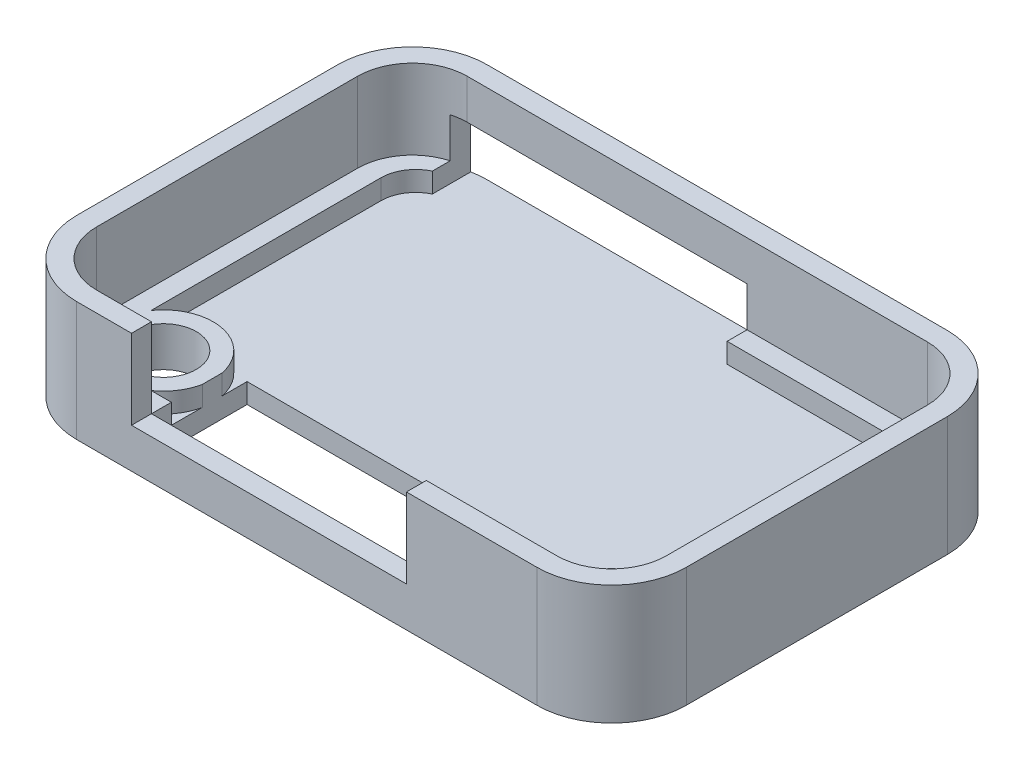
from build123d import *

# Parameters (mm, degrees)
SKETCH_1_W          = 30.6
SKETCH_1_H          = 20.6
EXTRUDE_1_DEPTH     = 6
SKETCH_2_W          = 28.6
SKETCH_2_H          = 18.6
CUT_EXTRUDE_1_DEPTH = 4
SKETCH_3_W          = 26.6
SKETCH_3_H          = 16.6
CUT_EXTRUDE_2_DEPTH = 1
FILLET_1_R          = 2.75
FILLET_2_R          = 3.75
SKETCH_4_W          = 14.8
SKETCH_4_H          = 3
CUT_EXTRUDE_3_DEPTH = 5
FILLET_3_R          = 1.75
SKETCH_5_R          = 2.5
SKETCH_5_R_2        = 1.65
EXTRUDE_2_DEPTH     = 1
CUT_EXTRUDE_START   = -2
SKETCH_6_R          = 1.65
CUT_EXTRUDE_4_DEPTH = 2
SKETCH_7_W          = 13.8
SKETCH_7_H          = 4.8
CUT_EXTRUDE_5_DEPTH = 8
SKETCH_8_W          = 13.8
SKETCH_8_H          = 4
CUT_EXTRUDE_6_DEPTH = 10


with BuildPart() as part:
    # 草图1 → 凸台-拉伸1 (new body)
    with BuildSketch(Plane(origin=(0, 0, 0), x_dir=(1, 0, 0), z_dir=(0, 1, 0))):
        Rectangle(SKETCH_1_W, SKETCH_1_H)
    extrude(amount=EXTRUDE_1_DEPTH)

    # 草图2 → 切除-拉伸1 (cut)
    with BuildSketch(Plane(origin=(0, 6, 0), x_dir=(1, 0, 0), z_dir=(0, 1, 0))):
        Rectangle(SKETCH_2_W, SKETCH_2_H)
    extrude(amount=-CUT_EXTRUDE_1_DEPTH, mode=Mode.SUBTRACT)

    # 草图3 → 切除-拉伸2 (cut)
    with BuildSketch(Plane(origin=(0, 2, 0), x_dir=(1, 0, 0), z_dir=(0, 1, 0))):
        Rectangle(SKETCH_3_W, SKETCH_3_H)
    extrude(amount=-CUT_EXTRUDE_2_DEPTH, mode=Mode.SUBTRACT)

    # 圆角1
    fillet_1_edges = [part.edges().sort_by_distance(p)[0] for p in [
        (-14.3, 4, 9.3),
        (-14.3, 4, -9.3),
        (14.3, 4, -9.3),
        (14.3, 4, 9.3),
    ]]
    fillet(fillet_1_edges, radius=FILLET_1_R)

    # 圆角2
    fillet_2_edges = [part.edges().sort_by_distance(p)[0] for p in [
        (-15.3, 3, -10.3),
        (15.3, 3, -10.3),
        (15.3, 3, 10.3),
        (-15.3, 3, 10.3),
    ]]
    fillet(fillet_2_edges, radius=FILLET_2_R)

    # 草图4 → 切除-拉伸3 (cut)
    with BuildSketch(Plane(origin=(0, 0, -10.3), x_dir=(-1, 0, 0), z_dir=(0, 0, -1))):
        with Locations((4.9, 2.5)):
            Rectangle(SKETCH_4_W, SKETCH_4_H)
    extrude(amount=-CUT_EXTRUDE_3_DEPTH, mode=Mode.SUBTRACT)

    # 圆角3
    # the kernel refuses this fillet: 1.75 mm, written as the material it adds along each edge
    with BuildSketch(Plane(origin=(-13.3, 2, 8.3), x_dir=(1, 0, 0), z_dir=(0, -1, 0)), Plane(origin=(13.3, 2, -8.3), x_dir=(-1, 0, 0), z_dir=(0, -1, 0)), Plane(origin=(13.3, 2, 8.3), x_dir=(0, 0, -1), z_dir=(0, -1, 0))) as fillet_3_piece_1:
        with BuildLine():
            CenterArc((FILLET_3_R, -FILLET_3_R), FILLET_3_R, 90, 90)
            Line((0, -FILLET_3_R), (-FILLET_3_R * 0.02, -FILLET_3_R))
            Line((-FILLET_3_R * 0.02, -FILLET_3_R), (-FILLET_3_R * 0.02, FILLET_3_R * 0.02))
            Line((-FILLET_3_R * 0.02, FILLET_3_R * 0.02), (FILLET_3_R, FILLET_3_R * 0.02))
            Line((FILLET_3_R, FILLET_3_R * 0.02), (FILLET_3_R, 0))
        make_face()
    extrude(amount=1)
    with BuildSketch(Plane(origin=(-13.3, 2, -8.3), x_dir=(1, 0, 0), z_dir=(0, -1, 0))) as fillet_3_piece_2:
        with BuildLine():
            CenterArc((1.75, 1.58113883), FILLET_3_R, 180, 64.623066475)
            Line((0, 1.58113883), (-0.035, 1.58113883))
            Line((-0.035, 1.58113883), (-0.035, 0))
            Line((-0.035, 0), (0, -0.035))
            ThreePointArc((0, -0.035), (0.5, -0.035), (0.985, -0.031622777))
            Line((0.985, -0.031622777), (1, 0))
        make_face()
    extrude(amount=1)

    # 草图5 → 凸台-拉伸2 (add)
    # profile 1 of 2: a face of its own
    with BuildSketch(Plane(origin=(0, 1, 0), x_dir=(1, 0, 0), z_dir=(0, 1, 0))):
        with Locations((-11.25, -6.25)):
            Circle(SKETCH_5_R)
        with Locations(Location((-11.25, -6.25, 0), (0, 0, 270))):
            Circle(SKETCH_5_R_2, mode=Mode.SUBTRACT)
    # profile 2 of 2: a face of its own
    with BuildSketch(Plane(origin=(0, 1, 0), x_dir=(1, 0, 0), z_dir=(0, 1, 0))):
        with Locations((11.25, -6.25)):
            Circle(SKETCH_5_R)
        with Locations(Location((11.25, -6.25, 0), (0, 0, 270))):
            Circle(SKETCH_5_R_2, mode=Mode.SUBTRACT)
    extrude(amount=EXTRUDE_2_DEPTH)

    # 草图6 → 切除-拉伸4 (cut)
    with BuildSketch(Plane(origin=(0, 1, 0), x_dir=(1, 0, 0), z_dir=(0, 1, 0)).offset(CUT_EXTRUDE_START)):
        with Locations(Location((-11.25, -6.25, 0), (0, 0, 270))):
            Circle(SKETCH_6_R)
        with Locations(Location((11.25, -6.25, 0), (0, 0, 270))):
            Circle(SKETCH_6_R)
    extrude(amount=CUT_EXTRUDE_4_DEPTH, mode=Mode.SUBTRACT)

    # 草图7 → 切除-拉伸5 (cut)
    with BuildSketch(Plane(origin=(0, 6, 0), x_dir=(1, 0, 0), z_dir=(0, 1, 0))):
        with Locations((-1.9, -6.9)):
            Rectangle(SKETCH_7_W, SKETCH_7_H)
    extrude(amount=-CUT_EXTRUDE_5_DEPTH, mode=Mode.SUBTRACT)

    # 草图8 → 切除-拉伸6 (cut)
    with BuildSketch(Plane(origin=(0, 0, 9.3), x_dir=(-1, 0, 0), z_dir=(0, 0, -1))):
        with Locations((1.9, 4)):
            Rectangle(SKETCH_8_W, SKETCH_8_H)
    extrude(amount=-CUT_EXTRUDE_6_DEPTH, mode=Mode.SUBTRACT)


solid = part.part
